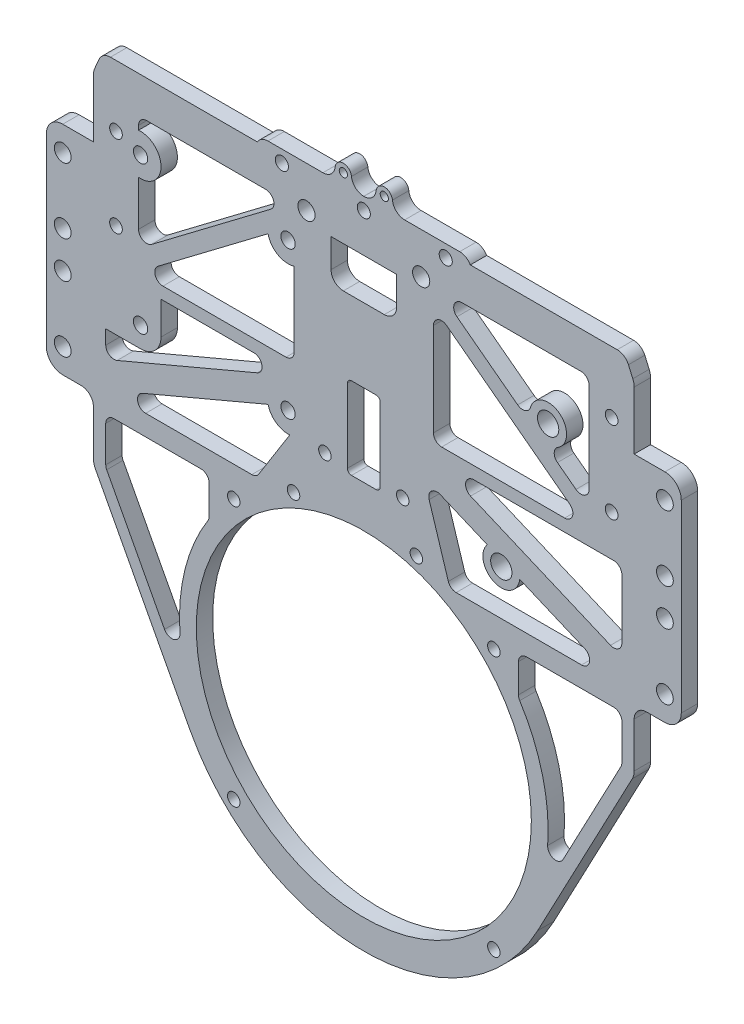
from build123d import *

# Parameters (mm, degrees)
SKETCH_1_R           = 40.9
SKETCH_1_R_2         = 1.525
SKETCH_1_R_3         = 2.1
EXTRUDE_1_DEPTH      = 4
EXTRUDE_2_DEPTH      = 4
SKETCH_4_R           = 1.55
CUT_EXTRUDE_2_DEPTH  = 10
CUT_EXTRUDE_3_DEPTH  = 10
SKETCH_6_R           = 2.05
EXTRUDE_3_DEPTH      = 4
FILLET_1_R           = 3
FILLET_2_R           = 2
FILLET_3_R           = 4
CUT_EXTRUDE_5_DEPTH  = 10
CUT_EXTRUDE_6_DEPTH  = 178.916441062
CUT_EXTRUDE_7_DEPTH  = 178.916441062
SKETCH_11_R          = 2.05
EXTRUDE_4_DEPTH      = 4
SKETCH_11_2_R        = 2.05
CUT_EXTRUDE_9_DEPTH  = 10
SKETCH_12_W          = 52
SKETCH_12_H          = 55
CUT_EXTRUDE_10_DEPTH = 178.916441062
SKETCH_13_W          = 8
SKETCH_13_H          = 50
EXTRUDE_5_DEPTH      = 4
SKETCH_14_R          = 1.5
CUT_EXTRUDE_11_DEPTH = 178.916441062
SKETCH_15_R          = 4.5
SKETCH_15_R_2        = 2.6
EXTRUDE_6_DEPTH      = 4
SKETCH_15_2_R        = 2.6
CUT_EXTRUDE_12_DEPTH = 178.916441062
SKETCH_16_R          = 5
SKETCH_16_R_2        = 1.75
EXTRUDE_7_DEPTH      = 4
SKETCH_16_2_R        = 1.75
CUT_EXTRUDE_13_DEPTH = 178.916441062
SKETCH_17_W          = 40
SKETCH_17_H          = 50
CUT_EXTRUDE_15_DEPTH = 178.916441062
EXTRUDE_START        = -4
SKETCH_18_R          = 1.6
SKETCH_18_R_2        = 1
EXTRUDE_8_DEPTH      = 4
FILLET_4_R           = 2
FILLET_5_R           = 3


with BuildPart() as part:
    # 草图1 → 凸台-拉伸1 (new body)
    with BuildSketch(Plane.XY):
        with BuildLine():
            Line((-48, 105.1), (48, 105.1))
            Line((48, 105.1), (66, 105.1))
            Line((66, 105.1), (66, 22.1))
            Line((66, 22.1), (42.426415371, -22.449928257))
            ThreePointArc((42.426415371, -22.449928257), (0, -48), (-42.426415371, -22.449928257))
            Line((-42.426415371, -22.449928257), (-66, 22.1))
            Line((-66, 22.1), (-66, 105.1))
            Line((-66, 105.1), (-48, 105.1))
        make_face()
        Circle(SKETCH_1_R, mode=Mode.SUBTRACT)
        with Locations((12.835117837, 41.981778787)):
            Circle(SKETCH_1_R_2, mode=Mode.SUBTRACT)
        with Locations((-17.153096541, 40.410163067)):
            Circle(SKETCH_1_R_2, mode=Mode.SUBTRACT)
        with Locations((-31.749094475, 31.749094475)):
            Circle(SKETCH_1_R_2, mode=Mode.SUBTRACT)
        with Locations((31.749094475, 31.749094475)):
            Circle(SKETCH_1_R_2, mode=Mode.SUBTRACT)
        with Locations((31.749094475, -31.749094475)):
            Circle(SKETCH_1_R_2, mode=Mode.SUBTRACT)
        with Locations((-31.749094475, -31.749094475)):
            Circle(SKETCH_1_R_2, mode=Mode.SUBTRACT)
        with Locations((-14, 101.6)):
            Circle(SKETCH_1_R_3, mode=Mode.SUBTRACT)
        with Locations((14, 101.6)):
            Circle(SKETCH_1_R_3, mode=Mode.SUBTRACT)
        with Locations((-9.5, 52.6)):
            Circle(SKETCH_1_R_2, mode=Mode.SUBTRACT)
        with Locations((9.5, 52.6)):
            Circle(SKETCH_1_R_2, mode=Mode.SUBTRACT)
    extrude(amount=EXTRUDE_1_DEPTH)

    # 草图3 → 凸台-拉伸2 (add)
    with BuildSketch(Plane.XY.offset(4)):
        Polygon((-66, 105.1), (-42, 160.1), (-22, 160.1), (-22, 105.1), align=None)
        Polygon((22, 160.1), (22, 105.1), (66, 105.1), (42, 160.1), align=None)
    extrude(amount=-EXTRUDE_2_DEPTH)

    # 草图4 → 切除-拉伸2 (cut)
    with BuildSketch(Plane.XY.offset(4)):
        with Locations((-60.5, 95.1)):
            Circle(SKETCH_4_R)
        with Locations((-60.5, 75.1)):
            Circle(SKETCH_4_R)
        with Locations((-42.333287047, 149.334828392)):
            Circle(SKETCH_4_R)
        with Locations((-50.332176167, 131.004040825)):
            Circle(SKETCH_4_R)
        with Locations((60.5, 75.1)):
            Circle(SKETCH_4_R)
        with Locations((60.5, 95.1)):
            Circle(SKETCH_4_R)
        with Locations((50.332176167, 131.004040825)):
            Circle(SKETCH_4_R)
        with Locations((42.333287047, 149.334828392)):
            Circle(SKETCH_4_R)
    extrude(amount=-CUT_EXTRUDE_2_DEPTH, mode=Mode.SUBTRACT)

    # 草图5 → 切除-拉伸3 (cut)
    with BuildSketch(Plane.XY.offset(4)):
        with BuildLine():
            Line((-8, 105.1), (8, 105.1))
            Line((8, 105.1), (8, 92.1))
            ThreePointArc((8, 92.1), (7.121320344, 89.978679656), (5, 89.1))
            Line((5, 89.1), (-5, 89.1))
            ThreePointArc((-5, 89.1), (-7.121320344, 89.978679656), (-8, 92.1))
            Line((-8, 92.1), (-8, 105.1))
        make_face()
    extrude(amount=-CUT_EXTRUDE_3_DEPTH, mode=Mode.SUBTRACT)

    # 草图6 → 凸台-拉伸3 (add)
    # profile 1 of 2: a face of its own
    with BuildSketch(Plane.XY.offset(4)):
        with BuildLine():
            Line((-66, 74.1), (-73.5, 74.1))
            ThreePointArc((-73.5, 74.1), (-76.328427125, 72.928427125), (-77.5, 70.1))
            Line((-77.5, 70.1), (-77.5, 41.1))
            ThreePointArc((-77.5, 41.1), (-76.328427125, 38.271572875), (-73.5, 37.1))
            Line((-73.5, 37.1), (-66, 37.1))
            Line((-66, 37.1), (-66, 74.1))
        make_face()
        with Locations((-73.5, 68.1)):
            Circle(SKETCH_6_R, mode=Mode.SUBTRACT)
        with Locations((-73.5, 43.1)):
            Circle(SKETCH_6_R, mode=Mode.SUBTRACT)
    # profile 2 of 2: a face of its own
    with BuildSketch(Plane.XY.offset(4)):
        with BuildLine():
            Line((66, 37.1), (73.5, 37.1))
            ThreePointArc((73.5, 37.1), (76.328427125, 38.271572875), (77.5, 41.1))
            Line((77.5, 41.1), (77.5, 70.1))
            ThreePointArc((77.5, 70.1), (76.328427125, 72.928427125), (73.5, 74.1))
            Line((73.5, 74.1), (66, 74.1))
            Line((66, 74.1), (66, 37.1))
        make_face()
        with Locations((73.5, 43.1)):
            Circle(SKETCH_6_R, mode=Mode.SUBTRACT)
        with Locations((73.5, 68.1)):
            Circle(SKETCH_6_R, mode=Mode.SUBTRACT)
    extrude(amount=-EXTRUDE_3_DEPTH)

    # 圆角1
    fillet_1_edges = [part.edges().sort_by_distance(p)[0] for p in [
        (8, 105.1, 2),
        (-8, 105.1, 2),
        (-66, 37.1, 2),
        (-66, 74.1, 2),
        (66, 74.1, 2),
        (66, 37.1, 2),
    ]]
    fillet(fillet_1_edges, radius=FILLET_1_R)

    # 圆角2
    fillet_2_edges = [part.edges().sort_by_distance(p)[0] for p in [
        (-22, 105.1, 2),
        (22, 105.1, 2),
    ]]
    fillet(fillet_2_edges, radius=FILLET_2_R)

    # 圆角3
    fillet_3_edges = [part.edges().sort_by_distance(p)[0] for p in [
        (66, 105.1, 2),
        (66, 22.1, 2),
        (-66, 22.1, 2),
        (-66, 105.1, 2),
        (-42, 160.1, 2),
        (-22, 160.1, 2),
        (22, 160.1, 2),
        (42, 160.1, 2),
    ]]
    fillet(fillet_3_edges, radius=FILLET_3_R)

    # 草图8 → 切除-拉伸5 (cut)
    with BuildSketch(Plane.XY.offset(4)):
        with BuildLine():
            Line((-3, 51.1), (3, 51.1))
            ThreePointArc((3, 51.1), (3.707106781, 51.392893219), (4, 52.1))
            Line((4, 52.1), (4, 70.1))
            ThreePointArc((4, 70.1), (3.707106781, 70.807106781), (3, 71.1))
            Line((3, 71.1), (-3, 71.1))
            ThreePointArc((-3, 71.1), (-3.707106781, 70.807106781), (-4, 70.1))
            Line((-4, 70.1), (-4, 52.1))
            ThreePointArc((-4, 52.1), (-3.707106781, 51.392893219), (-3, 51.1))
        make_face()
    extrude(amount=-CUT_EXTRUDE_5_DEPTH, mode=Mode.SUBTRACT)

    # 草图9 → 切除-拉伸6 (cut, through all)
    with BuildSketch(Plane.XY.offset(4)):
        with BuildLine():
            Line((-53.257042493, 114.299833368), (-37.547951584, 150.299833368))
            ThreePointArc((-37.547951584, 150.299833368), (-36.441577177, 151.609930288), (-34.798333449, 152.1))
            Line((-34.798333449, 152.1), (-33, 152.1))
            ThreePointArc((-33, 152.1), (-30.878679656, 151.221320344), (-30, 149.1))
            Line((-30, 149.1), (-30, 113.1))
            ThreePointArc((-30, 113.1), (-30.878679656, 110.978679656), (-33, 110.1))
            Line((-33, 110.1), (-50.507424358, 110.1))
            ThreePointArc((-50.507424358, 110.1), (-53.017354646, 111.456756273), (-53.257042493, 114.299833368))
        make_face()
        with BuildLine():
            Line((33, 110.1), (50.507424358, 110.1))
            ThreePointArc((50.507424358, 110.1), (53.017354646, 111.456756273), (53.257042493, 114.299833368))
            Line((53.257042493, 114.299833368), (37.547951584, 150.299833368))
            ThreePointArc((37.547951584, 150.299833368), (36.441577177, 151.609930288), (34.798333449, 152.1))
            Line((34.798333449, 152.1), (33, 152.1))
            ThreePointArc((33, 152.1), (30.878679656, 151.221320344), (30, 149.1))
            Line((30, 149.1), (30, 113.1))
            ThreePointArc((30, 113.1), (30.878679656, 110.978679656), (33, 110.1))
        make_face()
    extrude(amount=-CUT_EXTRUDE_6_DEPTH, mode=Mode.SUBTRACT)

    # 草图10 → 切除-拉伸7 (cut, through all)
    with BuildSketch(Plane.XY.offset(4)):
        with BuildLine():
            Line((48.648877735, -4.27629455), (62.767767307, 22.405923169))
            ThreePointArc((62.767767307, 22.405923169), (62.941073751, 22.859431573), (63, 23.341336846))
            Line((63, 23.341336846), (63, 32.1))
            ThreePointArc((63, 32.1), (62.414213562, 33.514213562), (61, 34.1))
            Line((61, 34.1), (39.749094475, 34.1))
            ThreePointArc((39.749094475, 34.1), (38.334880913, 33.514213562), (37.749094475, 32.1))
            Line((37.749094475, 32.1), (37.749094475, 25.080061571))
            ThreePointArc((37.749094475, 25.080061571), (37.827779606, 24.524589545), (38.057643647, 24.012824908))
            ThreePointArc((38.057643647, 24.012824908), (43.646718356, 10.952806798), (44.886169559, -3.198715729))
            ThreePointArc((44.886169559, -3.198715729), (46.330478078, -5.263588343), (48.648877735, -4.27629455))
        make_face()
        with BuildLine():
            Line((-61, 34.1), (-39.749094475, 34.1))
            ThreePointArc((-39.749094475, 34.1), (-38.334880913, 33.514213562), (-37.749094475, 32.1))
            Line((-37.749094475, 32.1), (-37.749094475, 25.080061571))
            ThreePointArc((-37.749094475, 25.080061571), (-37.827779606, 24.524589545), (-38.057643647, 24.012824908))
            ThreePointArc((-38.057643647, 24.012824908), (-43.646718356, 10.952806798), (-44.886169559, -3.198715729))
            ThreePointArc((-44.886169559, -3.198715729), (-46.330478078, -5.263588343), (-48.648877735, -4.27629455))
            Line((-48.648877735, -4.27629455), (-62.767767307, 22.405923169))
            ThreePointArc((-62.767767307, 22.405923169), (-62.941073751, 22.859431573), (-63, 23.341336846))
            Line((-63, 23.341336846), (-63, 32.1))
            ThreePointArc((-63, 32.1), (-62.414213562, 33.514213562), (-61, 34.1))
        make_face()
        with BuildLine():
            Line((17, 70.1), (17, 92.806128448))
            ThreePointArc((17, 92.806128448), (18.108955724, 94.596670293), (20.206040099, 94.401580509))
            Line((20.206040099, 94.401580509), (50.243631279, 71.695452061))
            ThreePointArc((50.243631279, 71.695452061), (50.93375891, 69.463959169), (49.03759118, 68.1))
            Line((49.03759118, 68.1), (19, 68.1))
            ThreePointArc((19, 68.1), (17.585786438, 68.685786438), (17, 70.1))
        make_face()
        with BuildLine():
            Line((23.940490506, 101.1), (53, 101.1))
            ThreePointArc((53, 101.1), (54.414213562, 100.514213562), (55, 99.1))
            Line((55, 99.1), (55, 77.133226724))
            ThreePointArc((55, 77.133226724), (53.891044276, 75.342684879), (51.793959901, 75.537774663))
            Line((51.793959901, 75.537774663), (22.734450408, 97.504547939))
            ThreePointArc((22.734450408, 97.504547939), (22.044322776, 99.736040831), (23.940490506, 101.1))
        make_face()
        with BuildLine():
            Line((18.630994885, 57.887673867), (53.927449494, 42.941693534))
            ThreePointArc((53.927449494, 42.941693534), (55.107624057, 40.702122549), (53.147600196, 39.1))
            Line((53.147600196, 39.1), (22.54558589, 39.1))
            ThreePointArc((22.54558589, 39.1), (21.362082606, 39.48775933), (20.637493763, 40.500680023))
            Line((20.637493763, 40.500680023), (15.94305346, 55.446660357))
            ThreePointArc((15.94305346, 55.446660357), (16.506575131, 57.526564775), (18.630994885, 57.887673867))
        make_face()
        with BuildLine():
            Line((26.838340437, 65.1), (61, 65.1))
            ThreePointArc((61, 65.1), (62.414213562, 64.514213562), (63, 63.1))
            Line((63, 63.1), (63, 48.634538875))
            ThreePointArc((63, 48.634538875), (62.104604319, 46.967250868), (60.220150702, 46.792845341))
            Line((60.220150702, 46.792845341), (26.058491139, 61.258306466))
            ThreePointArc((26.058491139, 61.258306466), (24.878316576, 63.497877451), (26.838340437, 65.1))
        make_face()
        with BuildLine():
            Line((-55, 99.1), (-55, 77.133226724))
            ThreePointArc((-55, 77.133226724), (-53.891044276, 75.342684879), (-51.793959901, 75.537774663))
            Line((-51.793959901, 75.537774663), (-22.734450408, 97.504547939))
            ThreePointArc((-22.734450408, 97.504547939), (-22.044322776, 99.736040831), (-23.940490506, 101.1))
            Line((-23.940490506, 101.1), (-53, 101.1))
            ThreePointArc((-53, 101.1), (-54.414213562, 100.514213562), (-55, 99.1))
        make_face()
        with BuildLine():
            Line((-20.206040099, 94.401580509), (-50.243631279, 71.695452061))
            ThreePointArc((-50.243631279, 71.695452061), (-50.93375891, 69.463959169), (-49.03759118, 68.1))
            Line((-49.03759118, 68.1), (-19, 68.1))
            ThreePointArc((-19, 68.1), (-17.585786438, 68.685786438), (-17, 70.1))
            Line((-17, 70.1), (-17, 92.806128448))
            ThreePointArc((-17, 92.806128448), (-18.108955724, 94.596670293), (-20.206040099, 94.401580509))
        make_face()
        with BuildLine():
            Line((-63, 63.1), (-63, 48.634538875))
            ThreePointArc((-63, 48.634538875), (-62.104604319, 46.967250868), (-60.220150702, 46.792845341))
            Line((-60.220150702, 46.792845341), (-26.058491139, 61.258306466))
            ThreePointArc((-26.058491139, 61.258306466), (-24.878316576, 63.497877451), (-26.838340437, 65.1))
            Line((-26.838340437, 65.1), (-61, 65.1))
            ThreePointArc((-61, 65.1), (-62.414213562, 64.514213562), (-63, 63.1))
        make_face()
        with BuildLine():
            Line((-54.039558509, 42.941693534), (-18.7431039, 57.887673867))
            ThreePointArc((-18.7431039, 57.887673867), (-16.440496352, 57.342594119), (-16.269412856, 54.982542448))
            Line((-16.269412856, 54.982542448), (-25.652887878, 40.036562114))
            ThreePointArc((-25.652887878, 40.036562114), (-26.378968231, 39.349732053), (-27.346729625, 39.1))
            Line((-27.346729625, 39.1), (-53.259709212, 39.1))
            ThreePointArc((-53.259709212, 39.1), (-55.219733072, 40.702122549), (-54.039558509, 42.941693534))
        make_face()
    extrude(amount=-CUT_EXTRUDE_7_DEPTH, mode=Mode.SUBTRACT)

    # 草图11 → 凸台-拉伸4 (add)
    # profile 1 of 2: a face of its own
    with BuildSketch(Plane.XY):
        with BuildLine():
            Line((-66, 77.1), (-66, 90.1))
            Line((-66, 90.1), (-73.5, 90.1))
            ThreePointArc((-73.5, 90.1), (-76.328427125, 88.928427125), (-77.5, 86.1))
            Line((-77.5, 86.1), (-77.5, 70.1))
            ThreePointArc((-77.5, 70.1), (-76.328427125, 72.928427125), (-73.5, 74.1))
            Line((-73.5, 74.1), (-69, 74.1))
            ThreePointArc((-69, 74.1), (-66.878679656, 74.978679656), (-66, 77.1))
        make_face()
        with Locations(Location((-73.5, 84.1, 0), (0, 0, 180))):
            Circle(SKETCH_11_R, mode=Mode.SUBTRACT)
    # profile 2 of 2: a face of its own
    with BuildSketch(Plane.XY):
        with BuildLine():
            ThreePointArc((73.5, 74.1), (76.328427125, 72.928427125), (77.5, 70.1))
            Line((77.5, 70.1), (77.5, 86.1))
            ThreePointArc((77.5, 86.1), (76.328427125, 88.928427125), (73.5, 90.1))
            Line((73.5, 90.1), (66, 90.1))
            Line((66, 90.1), (66, 77.1))
            ThreePointArc((66, 77.1), (66.878679656, 74.978679656), (69, 74.1))
            Line((69, 74.1), (73.5, 74.1))
        make_face()
        with Locations(Location((73.5, 84.1, 0), (0, 0, 180))):
            Circle(SKETCH_11_R, mode=Mode.SUBTRACT)
    extrude(amount=EXTRUDE_4_DEPTH)

    # 草图11<2> → 切除-拉伸9 (cut)
    with BuildSketch(Plane.XY):
        with Locations((-73.5, 59.1)):
            Circle(SKETCH_11_2_R)
        with Locations(Location((73.5, 59.1, 0), (0, 0, 180))):
            Circle(SKETCH_11_2_R)
    extrude(amount=CUT_EXTRUDE_9_DEPTH, mode=Mode.SUBTRACT)

    # 草图12 → 切除-拉伸10 (cut, through all)
    with BuildSketch(Plane.XY.offset(4)):
        with Locations((0, 132.6)):
            Rectangle(SKETCH_12_W, SKETCH_12_H)
    extrude(amount=-CUT_EXTRUDE_10_DEPTH, mode=Mode.SUBTRACT)

    # 草图13 → 凸台-拉伸5 (add)
    with BuildSketch(Plane.XY.offset(4)):
        with Locations((-30, 130.1)):
            Rectangle(SKETCH_13_W, SKETCH_13_H)
        with Locations((30, 130.1)):
            Rectangle(SKETCH_13_W, SKETCH_13_H)
    extrude(amount=-EXTRUDE_5_DEPTH)

    # 草图14 → 切除-拉伸11 (cut, through all)
    with BuildSketch(Plane(origin=(0, 0, 0), x_dir=(-1, 0, 0), z_dir=(0, 0, -1))):
        with Locations((-31, 137.1)):
            Circle(SKETCH_14_R)
        with Locations((-31, 117.1)):
            Circle(SKETCH_14_R)
        with Locations(Location((31, 117.1, 0), (0, 0, 180))):
            Circle(SKETCH_14_R)
        with Locations(Location((31, 137.1, 0), (0, 0, 180))):
            Circle(SKETCH_14_R)
    extrude(amount=-CUT_EXTRUDE_11_DEPTH, mode=Mode.SUBTRACT)

    # 草图15 → 凸台-拉伸6 (add)
    # profile 1 of 2: a face of its own
    with BuildSketch(Plane.XY.offset(4)):
        with Locations((45, 86.04)):
            Circle(SKETCH_15_R)
        with Locations((45, 86.04)):
            Circle(SKETCH_15_R_2, mode=Mode.SUBTRACT)
    # profile 2 of 2: a face of its own
    with BuildSketch(Plane.XY.offset(4)):
        with Locations((33.57, 50.1)):
            Circle(SKETCH_15_R)
        with Locations((33.57, 50.1)):
            Circle(SKETCH_15_R_2, mode=Mode.SUBTRACT)
    extrude(amount=-EXTRUDE_6_DEPTH)

    # 草图15<2> → 切除-拉伸12 (cut, through all)
    with BuildSketch(Plane.XY.offset(4)):
        with Locations((45, 86.04)):
            Circle(SKETCH_15_2_R)
        with Locations((33.57, 50.1)):
            Circle(SKETCH_15_2_R)
    extrude(amount=-CUT_EXTRUDE_12_DEPTH, mode=Mode.SUBTRACT)

    # 草图16 → 凸台-拉伸7 (add)
    # profile 1 of 4: a face of its own
    with BuildSketch(Plane.XY.offset(4)):
        with Locations((-18.5, 93.1)):
            Circle(SKETCH_16_R)
        with Locations((-18.5, 93.1)):
            Circle(SKETCH_16_R_2, mode=Mode.SUBTRACT)
    # profile 2 of 4: a face of its own
    with BuildSketch(Plane.XY.offset(4)):
        with Locations((-18.5, 57.1)):
            Circle(SKETCH_16_R)
        with Locations((-18.5, 57.1)):
            Circle(SKETCH_16_R_2, mode=Mode.SUBTRACT)
    # profile 3 of 4: a face of its own
    with BuildSketch(Plane.XY.offset(4)):
        with BuildLine():
            Line((-54.5, 52.1), (-63, 52.1))
            Line((-63, 52.1), (-63, 63.1))
            ThreePointArc((-63, 63.1), (-62.414213562, 64.514213562), (-61, 65.1))
            Line((-61, 65.1), (-49.5, 65.1))
            Line((-49.5, 65.1), (-49.5, 57.1))
            ThreePointArc((-49.5, 57.1), (-50.964466094, 53.564466094), (-54.5, 52.1))
        make_face()
        with Locations((-54.5, 57.1)):
            Circle(SKETCH_16_R_2, mode=Mode.SUBTRACT)
    # profile 4 of 4: a face of its own
    with BuildSketch(Plane.XY.offset(4)):
        with BuildLine():
            ThreePointArc((-59.42057924, 93.987637279), (-49.75658351, 91.51886117), (-58.96904576, 95.342237721))
            ThreePointArc((-58.96904576, 95.342237721), (-59.029540888, 94.609846963), (-59.42057924, 93.987637279))
        make_face()
        with Locations((-54.5, 93.1)):
            Circle(SKETCH_16_R_2, mode=Mode.SUBTRACT)
    extrude(amount=-EXTRUDE_7_DEPTH)

    # 草图16<2> → 切除-拉伸13 (cut, through all)
    with BuildSketch(Plane.XY.offset(4)):
        with Locations((-54.5, 93.1)):
            Circle(SKETCH_16_2_R)
        with Locations((-18.5, 93.1)):
            Circle(SKETCH_16_2_R)
        with Locations((-18.5, 57.1)):
            Circle(SKETCH_16_2_R)
        with Locations((-54.5, 57.1)):
            Circle(SKETCH_16_2_R)
    extrude(amount=-CUT_EXTRUDE_13_DEPTH, mode=Mode.SUBTRACT)

    # 草图17 → 切除-拉伸15 (cut, through all)
    with BuildSketch(Plane.XY.offset(4)):
        with Locations((-46, 135.1)):
            Rectangle(SKETCH_17_W, SKETCH_17_H)
        with Locations((46, 135.1)):
            Rectangle(SKETCH_17_W, SKETCH_17_H)
    extrude(amount=-CUT_EXTRUDE_15_DEPTH, mode=Mode.SUBTRACT)

    # 草图18 → 凸台-拉伸8 (add)
    with BuildSketch(Plane.XY.offset(4).offset(EXTRUDE_START)):
        with BuildLine():
            Line((26, 105.1), (26, 111.6))
            Line((26, 111.6), (7, 111.6))
            Line((7, 111.6), (7, 114.1))
            ThreePointArc((7, 114.1), (5, 116.1), (3, 114.1))
            Line((3, 114.1), (3, 111.6))
            Line((3, 111.6), (-3, 111.6))
            Line((-3, 111.6), (-3, 114.1))
            ThreePointArc((-3, 114.1), (-5, 116.1), (-7, 114.1))
            Line((-7, 114.1), (-7, 111.6))
            Line((-7, 111.6), (-26, 111.6))
            Line((-26, 111.6), (-26, 105.1))
            Line((-26, 105.1), (-11, 105.1))
            ThreePointArc((-11, 105.1), (-8.878679656, 104.221320344), (-8, 102.1))
            Line((-8, 102.1), (-8, 99.1))
            Line((-8, 99.1), (8, 99.1))
            Line((8, 99.1), (8, 102.1))
            ThreePointArc((8, 102.1), (8.878679656, 104.221320344), (11, 105.1))
            Line((11, 105.1), (26, 105.1))
        make_face()
        with Locations((0, 108.6)):
            Circle(SKETCH_18_R, mode=Mode.SUBTRACT)
        with Locations((20, 108.6)):
            Circle(SKETCH_18_R, mode=Mode.SUBTRACT)
        with Locations((-20, 108.6)):
            Circle(SKETCH_18_R, mode=Mode.SUBTRACT)
        with Locations((-5, 114.1)):
            Circle(SKETCH_18_R_2, mode=Mode.SUBTRACT)
        with Locations((5, 114.1)):
            Circle(SKETCH_18_R_2, mode=Mode.SUBTRACT)
    extrude(amount=EXTRUDE_8_DEPTH)

    # 圆角4
    fillet_4_edges = [part.edges().sort_by_distance(p)[0] for p in [
        (41.312243472, 83.461153012, 2),
        (43.524693443, 81.788709541, 2),
    ]]
    fillet(fillet_4_edges, radius=FILLET_4_R)

    # 圆角5
    # the kernel refuses this fillet: 3 mm, written as the material it adds along each edge
    with BuildSketch(Plane(origin=(7, 111.6, 0), x_dir=(-0.003712983956324735, 0.9999931068513124, 0), z_dir=(0, 0, 1)), Plane(origin=(-3, 111.6, 0), x_dir=(-0.003712983956324735, 0.9999931068513124, 0), z_dir=(0, 0, 1))) as fillet_5_piece_1:
        with BuildLine():
            CenterArc((2.988933427, -2.986055631), FILLET_5_R, 95.526431678, 84.260829523)
            Line((-0.011045894, -2.974916679), (-0.311043826, -2.973802784))
            Line((-0.311043826, -2.973802784), (-0.299997932, 0.001113895))
            Line((-0.299997932, 0.001113895), (0.001113895, 0.299997932))
            ThreePointArc((0.001113895, 0.299997932), (2.501096662, 0.290715472), (2.67112713, 0.298605563))
            Line((2.67112713, 0.298605563), (2.700018612, 0))
        make_face()
    extrude(amount=4)
    with BuildSketch(Plane(origin=(3, 111.6, 0), x_dir=(-1, 0, 0), z_dir=(0, 0, 1)), Plane(origin=(-7, 111.6, 0), x_dir=(-1, 0, 0), z_dir=(0, 0, 1))) as fillet_5_piece_2:
        with BuildLine():
            CenterArc((2.974937186, -3), FILLET_5_R, 90, 84.260829523)
            Line((-0.010025126, -2.7), (-0.308521357, -2.67))
            ThreePointArc((-0.308521357, -2.67), (-0.3, -2.5), (-0.3, 0))
            Line((-0.3, 0), (0, 0.3))
            Line((0, 0.3), (2.974937186, 0.3))
            Line((2.974937186, 0.3), (2.974937186, 0))
        make_face()
    extrude(amount=4)
    # the kernel refuses this fillet: 3 mm, written as the material it takes off along each edge
    with BuildSketch(Plane(origin=(63.818181818, 110.1, 8.910227194), x_dir=(-1, 0, 0), z_dir=(0, 0, -1)), Plane(origin=(-63.818181818, 110.1, -4.910227194), x_dir=(1, 0, 0), z_dir=(0, 0, 1))) as fillet_5_2_piece_1:
        with BuildLine():
            CenterArc((FILLET_5_R * 0.654696959177, -FILLET_5_R), FILLET_5_R, 90, 66.425293798)
            Line((-FILLET_5_R * 0.261842419193, -FILLET_5_R * 0.600055543984), (0, 0))
            Line((0, 0), (FILLET_5_R * 0.654696959177, 0))
        make_face()
    extrude(amount=13.820454388, mode=Mode.SUBTRACT)
    with BuildSketch(Plane(origin=(-26, 111.6, -6.495190528), x_dir=(1, 0, 0), z_dir=(0, 0, 1))) as fillet_5_2_piece_2:
        with BuildLine():
            CenterArc((2.598076211, -3), FILLET_5_R, 90, 60)
            Line((0, -1.5), (0, 0))
            Line((0, 0), (2.598076211, 0))
        make_face()
    extrude(amount=16.990381057, mode=Mode.SUBTRACT)
    with BuildSketch(Plane(origin=(26, 111.6, -6.495190528), x_dir=(0, -1, 0), z_dir=(0, 0, 1))) as fillet_5_2_piece_3:
        with BuildLine():
            CenterArc((3, -2.598076211), FILLET_5_R, 120, 60)
            Line((0, -2.598076211), (0, 0))
            Line((0, 0), (1.5, 0))
        make_face()
    extrude(amount=16.990381057, mode=Mode.SUBTRACT)


solid = part.part
